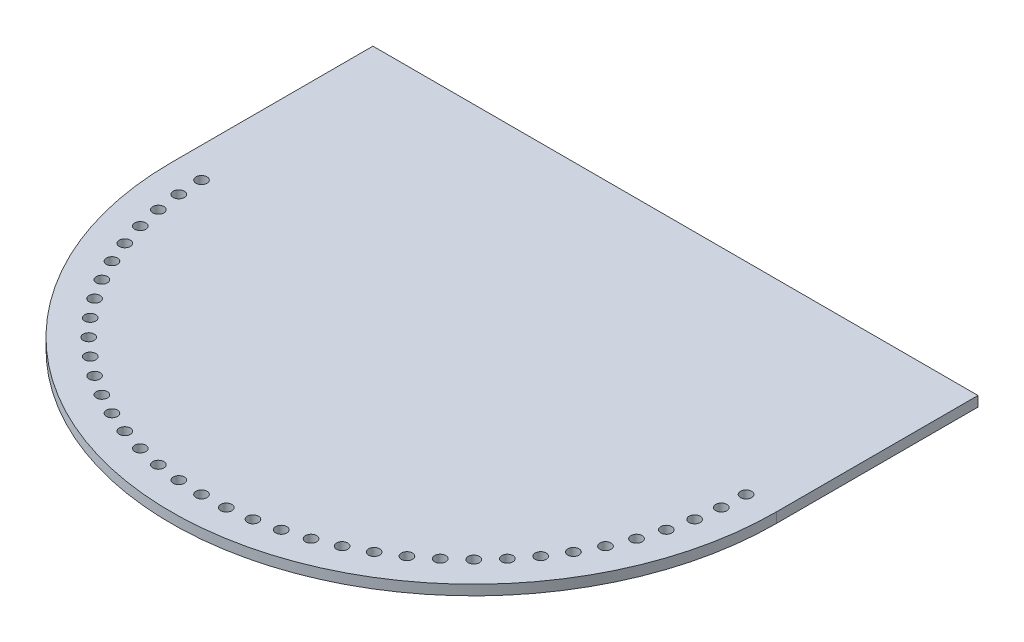
from build123d import *

# Parameters (mm, degrees)
SKETCH1_R           = 2.75
BOSS_EXTRUDE1_DEPTH = 5


with BuildPart() as part:
    # Sketch1 → Boss-Extrude1 (new body)
    with BuildSketch(Plane(origin=(0, 0, 0), x_dir=(1, 0, 0), z_dir=(0, 1, 0))):
        with BuildLine():
            Line((-150, 0), (-150, 100))
            Line((-150, 100), (150, 100))
            Line((150, 100), (150, 0))
            ThreePointArc((150, 0), (0, -150), (-150, 0))
        make_face()
        with Locations((135, 0)):
            Circle(SKETCH1_R, mode=Mode.SUBTRACT)
        with Locations((134.486284242, -11.766025271)):
            Circle(SKETCH1_R, mode=Mode.SUBTRACT)
        with Locations((132.949046657, -23.442503985)):
            Circle(SKETCH1_R, mode=Mode.SUBTRACT)
        with Locations((130.399986549, -34.940571089)):
            Circle(SKETCH1_R, mode=Mode.SUBTRACT)
        with Locations((126.858503806, -46.172719349)):
            Circle(SKETCH1_R, mode=Mode.SUBTRACT)
        with Locations((122.35155125, -57.053465335)):
            Circle(SKETCH1_R, mode=Mode.SUBTRACT)
        with Locations((116.913429511, -67.5)):
            Circle(SKETCH1_R, mode=Mode.SUBTRACT)
        with Locations((110.585525979, -77.432818907)):
            Circle(SKETCH1_R, mode=Mode.SUBTRACT)
        with Locations((103.415999821, -86.776327308)):
            Circle(SKETCH1_R, mode=Mode.SUBTRACT)
        with Locations((95.45941546, -95.45941546)):
            Circle(SKETCH1_R, mode=Mode.SUBTRACT)
        with Locations((86.776327308, -103.415999821)):
            Circle(SKETCH1_R, mode=Mode.SUBTRACT)
        with Locations((77.432818907, -110.585525979)):
            Circle(SKETCH1_R, mode=Mode.SUBTRACT)
        with Locations((67.5, -116.913429511)):
            Circle(SKETCH1_R, mode=Mode.SUBTRACT)
        with Locations((57.053465335, -122.35155125)):
            Circle(SKETCH1_R, mode=Mode.SUBTRACT)
        with Locations((46.172719349, -126.858503806)):
            Circle(SKETCH1_R, mode=Mode.SUBTRACT)
        with Locations((34.940571089, -130.399986549)):
            Circle(SKETCH1_R, mode=Mode.SUBTRACT)
        with Locations((23.442503985, -132.949046657)):
            Circle(SKETCH1_R, mode=Mode.SUBTRACT)
        with Locations((11.766025271, -134.486284242)):
            Circle(SKETCH1_R, mode=Mode.SUBTRACT)
        with Locations((0, -135)):
            Circle(SKETCH1_R, mode=Mode.SUBTRACT)
        with Locations((-11.766025271, -134.486284242)):
            Circle(SKETCH1_R, mode=Mode.SUBTRACT)
        with Locations((-23.442503985, -132.949046657)):
            Circle(SKETCH1_R, mode=Mode.SUBTRACT)
        with Locations((-34.940571089, -130.399986549)):
            Circle(SKETCH1_R, mode=Mode.SUBTRACT)
        with Locations((-46.172719349, -126.858503806)):
            Circle(SKETCH1_R, mode=Mode.SUBTRACT)
        with Locations((-57.053465335, -122.35155125)):
            Circle(SKETCH1_R, mode=Mode.SUBTRACT)
        with Locations((-67.5, -116.913429511)):
            Circle(SKETCH1_R, mode=Mode.SUBTRACT)
        with Locations((-77.432818907, -110.585525979)):
            Circle(SKETCH1_R, mode=Mode.SUBTRACT)
        with Locations((-86.776327308, -103.415999821)):
            Circle(SKETCH1_R, mode=Mode.SUBTRACT)
        with Locations((-95.45941546, -95.45941546)):
            Circle(SKETCH1_R, mode=Mode.SUBTRACT)
        with Locations((-103.415999821, -86.776327308)):
            Circle(SKETCH1_R, mode=Mode.SUBTRACT)
        with Locations((-110.585525979, -77.432818907)):
            Circle(SKETCH1_R, mode=Mode.SUBTRACT)
        with Locations((-116.913429511, -67.5)):
            Circle(SKETCH1_R, mode=Mode.SUBTRACT)
        with Locations((-122.35155125, -57.053465335)):
            Circle(SKETCH1_R, mode=Mode.SUBTRACT)
        with Locations((-126.858503806, -46.172719349)):
            Circle(SKETCH1_R, mode=Mode.SUBTRACT)
        with Locations((-130.399986549, -34.940571089)):
            Circle(SKETCH1_R, mode=Mode.SUBTRACT)
        with Locations((-132.949046657, -23.442503985)):
            Circle(SKETCH1_R, mode=Mode.SUBTRACT)
        with Locations((-134.486284242, -11.766025271)):
            Circle(SKETCH1_R, mode=Mode.SUBTRACT)
        with Locations((-135, 0)):
            Circle(SKETCH1_R, mode=Mode.SUBTRACT)
    extrude(amount=BOSS_EXTRUDE1_DEPTH)


solid = part.part
